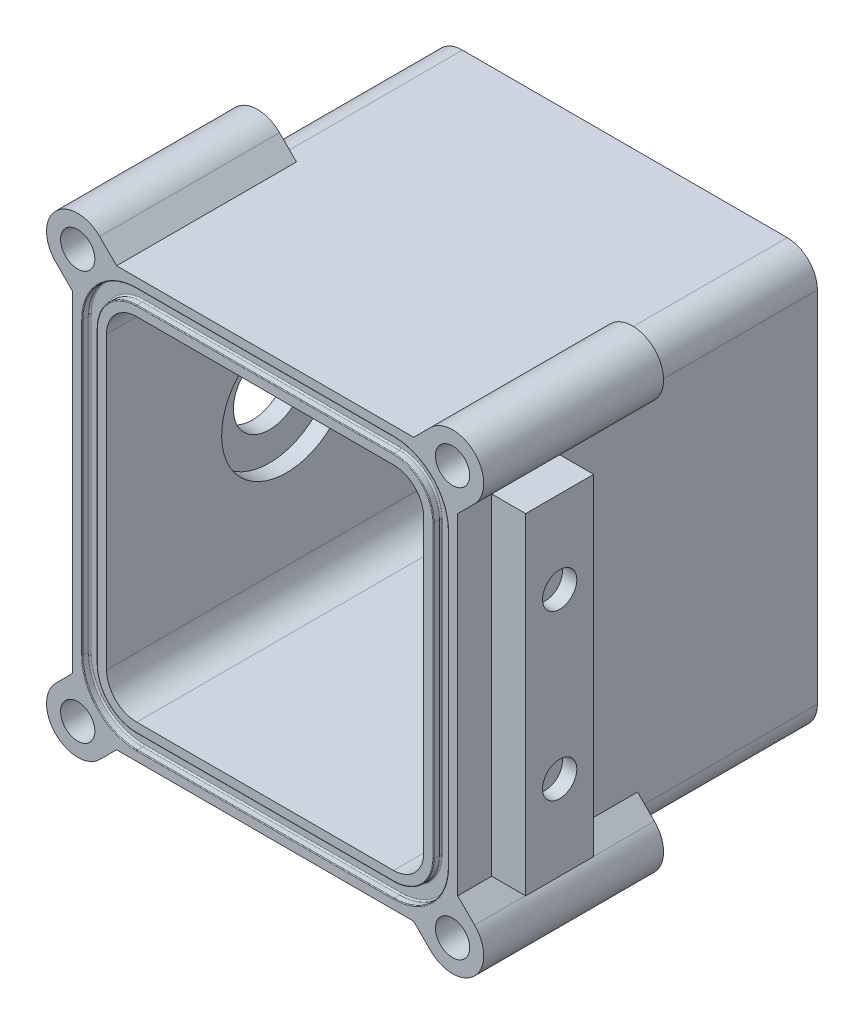
from build123d import *

# Parameters (mm, degrees)
BOSS_EXTRUDE1_DEPTH     = 31.75
SHELL1_T                = -6
FILLET1_R               = 5.334
CUT_EXTRUDE1_DEPTH      = 1.2954
FILLET2_R               = 0.254
FILLET3_R               = 0.127
BOSS_EXTRUDE2_DEPTH     = 31.75
SKETCH4_R               = 3.025
CUT_EXTRUDE2_DEPTH      = 9
MIRROR2_COPY_1_DEPTH    = 31.75
MIRROR2_COPY_2_SKETCH_R = 3.025
MIRROR2_COPY_2_DEPTH    = 9
SKETCH8_W               = 12
SKETCH8_H               = 58.443650814
BOSS_EXTRUDE3_DEPTH     = 6
SKETCH12_R              = 3.025
CUT_EXTRUDE6_DEPTH      = 2.54
SKETCH13_R              = 6.35
CUT_EXTRUDE10_DEPTH     = 6
SKETCH16_R              = 11.43
CUT_EXTRUDE14_DEPTH     = 3


with BuildPart() as part:
    # Sketch1 → Boss-Extrude1 (new, symmetric)
    with BuildSketch(Plane.XY):
        Polygon((-34, -37), (-34, -16.68), (-34, 16.68), (-34, 37), (34, 37), (34, -37), align=None)
    extrude(amount=BOSS_EXTRUDE1_DEPTH, both=True)

    # Shell1
    shell1_openings = [part.faces().sort_by_distance(p)[0] for p in [
        (0, 0, 31.75),
    ]]
    offset(amount=SHELL1_T, openings=shell1_openings, kind=Kind.INTERSECTION)

    # Fillet1
    fillet1_edges = [part.edges().sort_by_distance(p)[0] for p in [
        (34, 37, 0),
        (34, -37, 0),
        (-34, -37, 0),
        (-34, 37, 0),
        (28, 31, 3),
        (28, -31, 3),
        (-28, -31, 3),
        (-28, 31, 3),
    ]]
    fillet(fillet1_edges, radius=FILLET1_R)

    # Sketch2 → Cut-Extrude1 (cut)
    with BuildSketch(Plane.XY.offset(31.75)):
        with BuildLine():
            Line((32.2827, -25.666), (32.2827, 25.666))
            ThreePointArc((32.2827, 25.666), (29.466033783, 32.466033783), (22.666, 35.2827))
            Line((22.666, 35.2827), (-22.666, 35.2827))
            ThreePointArc((-22.666, 35.2827), (-29.466033783, 32.466033783), (-32.2827, 25.666))
            Line((-32.2827, 25.666), (-32.2827, -25.666))
            ThreePointArc((-32.2827, -25.666), (-29.466033783, -32.466033783), (-22.666, -35.2827))
            Line((-22.666, -35.2827), (22.666, -35.2827))
            ThreePointArc((22.666, -35.2827), (29.466033783, -32.466033783), (32.2827, -25.666))
        make_face()
        with BuildLine():
            Line((-29.7173, 25.666), (-29.7173, -25.666))
            ThreePointArc((-29.7173, -25.666), (-27.652022046, -30.652022046), (-22.666, -32.7173))
            Line((-22.666, -32.7173), (22.666, -32.7173))
            ThreePointArc((22.666, -32.7173), (27.652022046, -30.652022046), (29.7173, -25.666))
            Line((29.7173, -25.666), (29.7173, 25.666))
            ThreePointArc((29.7173, 25.666), (27.652022046, 30.652022046), (22.666, 32.7173))
            Line((22.666, 32.7173), (-22.666, 32.7173))
            ThreePointArc((-22.666, 32.7173), (-27.652022046, 30.652022046), (-29.7173, 25.666))
        make_face(mode=Mode.SUBTRACT)
    extrude(amount=-CUT_EXTRUDE1_DEPTH, mode=Mode.SUBTRACT)

    # Fillet2
    fillet2_edges = [part.edges().sort_by_distance(p)[0] for p in [
        (27.652022046, -30.652022046, 30.4546),
        (0, -32.7173, 30.4546),
        (-27.652022046, -30.652022046, 30.4546),
        (-29.7173, 0, 30.4546),
        (-27.652022046, 30.652022046, 30.4546),
        (0, 32.7173, 30.4546),
        (27.652022046, 30.652022046, 30.4546),
        (-29.466033783, 32.466033783, 30.4546),
        (0, 35.2827, 30.4546),
        (29.466033783, 32.466033783, 30.4546),
        (32.2827, 0, 30.4546),
        (29.466033783, -32.466033783, 30.4546),
        (0, -35.2827, 30.4546),
        (-29.466033783, -32.466033783, 30.4546),
        (29.7173, 0, 30.4546),
        (-32.2827, 0, 30.4546),
    ]]
    fillet(fillet2_edges, radius=FILLET2_R)

    # Fillet3
    fillet3_edges = [part.edges().sort_by_distance(p)[0] for p in [
        (-29.466033783, -32.466033783, 31.75),
        (-32.2827, 0, 31.75),
        (-29.466033783, 32.466033783, 31.75),
        (0, 35.2827, 31.75),
        (29.466033783, 32.466033783, 31.75),
        (32.2827, 0, 31.75),
        (29.466033783, -32.466033783, 31.75),
        (-27.652022046, -30.652022046, 31.75),
        (-29.7173, 0, 31.75),
        (-27.652022046, 30.652022046, 31.75),
        (0, 32.7173, 31.75),
        (27.652022046, 30.652022046, 31.75),
        (29.7173, 0, 31.75),
        (27.652022046, -30.652022046, 31.75),
        (0, -35.2827, 31.75),
        (0, -32.7173, 31.75),
    ]]
    fillet(fillet3_edges, radius=FILLET3_R)

    # Sketch3 → Boss-Extrude2 (add)
    with BuildSketch(Plane.XY.offset(31.75)):
        with BuildLine():
            ThreePointArc((30.741024965, -31.118858104), (29.555836344, -32.555836344), (28.118858104, -33.741024965))
            ThreePointArc((28.118858104, -33.741024965), (27.643498403, -35.335928432), (27.666944752, -37))
            Line((27.666944752, -37), (26.221825407, -37))
            Line((26.221825407, -37), (29.202282953, -39.980457546))
            ThreePointArc((29.202282953, -39.980457546), (36.980457546, -39.980457546), (36.980457546, -32.202282953))
            Line((36.980457546, -32.202282953), (34, -29.221825407))
            Line((34, -29.221825407), (34, -30.666944752))
            ThreePointArc((34, -30.666944752), (32.335928432, -30.643498403), (30.741024965, -31.118858104))
        make_face()
    boss_extrude2 = extrude(amount=-BOSS_EXTRUDE2_DEPTH)

    # Sketch4 → Cut-Extrude2 (cut)
    with BuildSketch(Plane.XY.offset(31.75)):
        with Locations((33.09137025, -36.09137025)):
            Circle(SKETCH4_R)
    cut_extrude2 = extrude(amount=-CUT_EXTRUDE2_DEPTH, mode=Mode.SUBTRACT)

    # Mirror1: Boss-Extrude2, Cut-Extrude2 across plane
    add(boss_extrude2.mirror(Plane.ZX))
    add(cut_extrude2.mirror(Plane.ZX), mode=Mode.SUBTRACT)

    # Mirror2: Boss-Extrude2, Cut-Extrude2 across plane
    add(boss_extrude2.mirror(Plane(origin=(0, 0, 0), x_dir=(0, 0, 1), z_dir=(1, 0, 0))))
    add(cut_extrude2.mirror(Plane(origin=(0, 0, 0), x_dir=(0, 0, 1), z_dir=(1, 0, 0))), mode=Mode.SUBTRACT)

    # Mirror2 copy 1 sketch → Mirror2 copy 1 (add)
    with BuildSketch(Plane(origin=(0, 0, 31.75), x_dir=(-1, 0, 0), z_dir=(0, 0, 1))):
        with BuildLine():
            ThreePointArc((30.741024965, -31.118858104), (29.555836344, -32.555836344), (28.118858104, -33.741024965))
            ThreePointArc((28.118858104, -33.741024965), (27.643498403, -35.335928432), (27.666944752, -37))
            Line((27.666944752, -37), (26.221825407, -37))
            Line((26.221825407, -37), (29.202282953, -39.980457546))
            ThreePointArc((29.202282953, -39.980457546), (36.980457546, -39.980457546), (36.980457546, -32.202282953))
            Line((36.980457546, -32.202282953), (34, -29.221825407))
            Line((34, -29.221825407), (34, -30.666944752))
            ThreePointArc((34, -30.666944752), (32.335928432, -30.643498403), (30.741024965, -31.118858104))
        make_face()
    extrude(amount=-MIRROR2_COPY_1_DEPTH)

    # Mirror2 copy 2 sketch → Mirror2 copy 2 (cut)
    with BuildSketch(Plane(origin=(0, 0, 31.75), x_dir=(-1, 0, 0), z_dir=(0, 0, 1))):
        with Locations((33.09137025, -36.09137025)):
            Circle(MIRROR2_COPY_2_SKETCH_R)
    extrude(amount=-MIRROR2_COPY_2_DEPTH, mode=Mode.SUBTRACT)

    # Sketch8 → Boss-Extrude3 (add)
    with BuildSketch(Plane.ZY.offset(34)):
        with Locations((19.75, 0)):
            Rectangle(SKETCH8_W, SKETCH8_H)
    boss_extrude3 = extrude(amount=BOSS_EXTRUDE3_DEPTH)

    # Sketch12 → Cut-Extrude6 (cut)
    with BuildSketch(Plane.ZY.offset(40)):
        with Locations((19.75, 14.616825407)):
            Circle(SKETCH12_R)
        with Locations((19.75, -14.339174593)):
            Circle(SKETCH12_R)
    cut_extrude6 = extrude(amount=-CUT_EXTRUDE6_DEPTH, mode=Mode.SUBTRACT)

    # Sketch13 → Cut-Extrude10 (cut)
    with BuildSketch(Plane.ZY.offset(34)):
        Circle(SKETCH13_R)
    extrude(amount=-CUT_EXTRUDE10_DEPTH, mode=Mode.SUBTRACT)

    # Sketch16 → Cut-Extrude14 (cut)
    with BuildSketch(Plane(origin=(-28, 0, 0), x_dir=(0, 0, -1), z_dir=(1, 0, 0))):
        Circle(SKETCH16_R)
    extrude(amount=-CUT_EXTRUDE14_DEPTH, mode=Mode.SUBTRACT)

    # Mirror5: Boss-Extrude3 across plane
    add(boss_extrude3.mirror(Plane(origin=(0, 0, 0), x_dir=(0, 0, 1), z_dir=(1, 0, 0))))

    # Mirror6: Cut-Extrude6 across plane
    add(cut_extrude6.mirror(Plane(origin=(0, 0, 0), x_dir=(0, 0, 1), z_dir=(1, 0, 0))), mode=Mode.SUBTRACT)


solid = part.part
